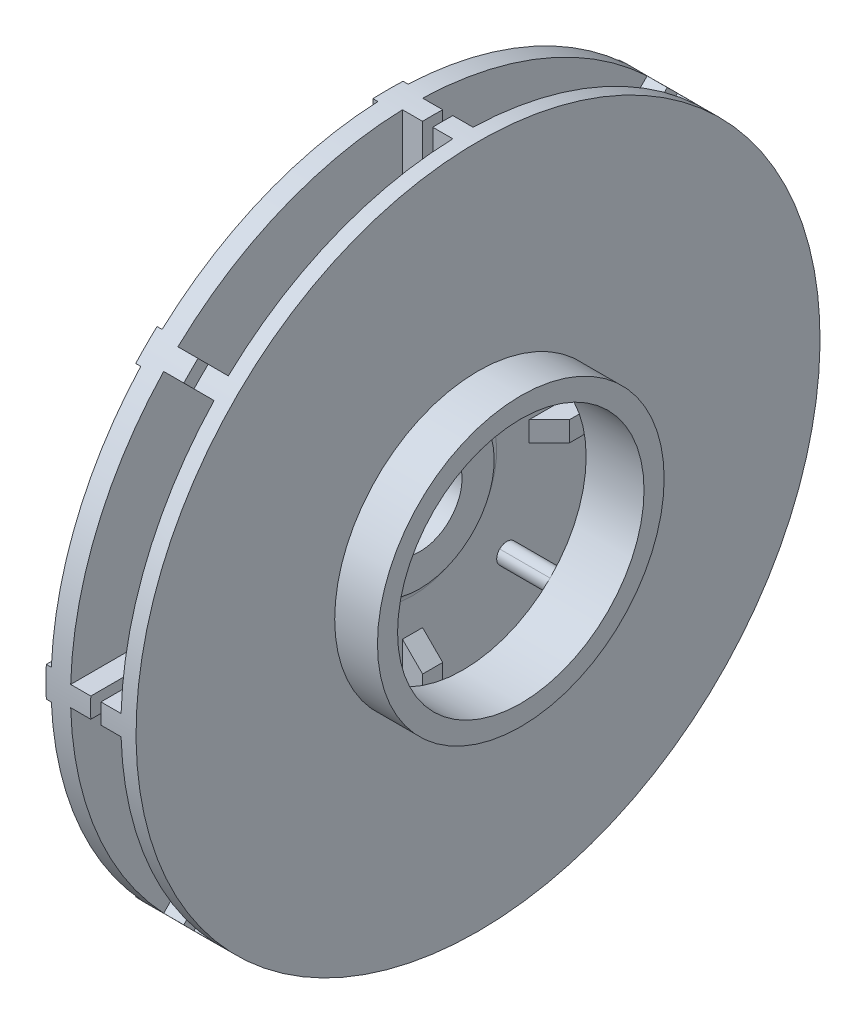
from build123d import *

# Parameters (mm, degrees)
BOSS_EXTRUDE3_DEPTH      = 6.35
FILLET1_R                = 6.35
CIRPATTERN5_COUNT        = 4
FILLET1_OF_CIRPATTERN5_R = 6.35
BOSS_EXTRUDE4_DEPTH      = 6.35
CIRPATTERN4_COUNT        = 4
SKETCH6_R                = 234.193665804
SKETCH6_R_2              = 215.9
CUT_EXTRUDE1_DEPTH       = 350.00288517
FILLET2_R                = 0.635
SKETCH7_R                = 60.93897947
CUT_EXTRUDE2_DEPTH       = 4.953
SKETCH8_R                = 79.670197019
CUT_EXTRUDE3_DEPTH       = 18.9484
CUT_EXTRUDE4_START       = 20.32
SKETCH11_R               = 219.71
SKETCH11_R_2             = 50.8
CUT_EXTRUDE4_DEPTH       = 20.32
CUT_EXTRUDE10_REACH      = 337.887
SKETCH20_R               = 30.226
SKETCH20_R_2             = 26.8224
CUT_EXTRUDE11_DEPTH      = 2.0066
CUT_EXTRUDE13_DEPTH      = 3.175
CIRPATTERN6_COUNT        = 8
SKETCH24_W               = 27.0002
SKETCH24_H               = 10.092146942
SKETCH25_R               = 26.6827
CUT_EXTRUDE14_DEPTH      = 20.32


with BuildPart() as part:
    # Sketch1 → Revolve2 (revolve)
    with BuildSketch(Plane.XY, mode=Mode.PRIVATE) as revolve2_sk:
        with BuildLine():
            Line((-140.081298787, 50.8), (-140.081298787, 0))
            Line((-140.081298787, 0), (-39.979898787, 0))
            Line((-39.979898787, 0), (-39.979898787, 46.736))
            Line((-39.979898787, 46.736), (-43.154898787, 46.736))
            ThreePointArc((-43.154898787, 46.736), (-47.645026847, 48.595871939), (-49.504898787, 53.086))
            Line((-49.504898787, 53.086), (-49.504898787, 219.71))
            Line((-49.504898787, 219.71), (-64.998898787, 219.71))
            Line((-64.998898787, 219.71), (-64.998898787, 63.5))
            ThreePointArc((-64.998898787, 63.5), (-68.718642666, 54.519743879), (-77.698898787, 50.8))
            Line((-77.698898787, 50.8), (-140.081298787, 50.8))
        make_face()
        with BuildLine():
            Line((-9.677698787, 219.71), (-17.678698787, 219.71))
            Line((-17.678698787, 219.71), (-17.678698787, 77.7875))
            Line((-17.678698787, 77.7875), (1.650701213, 77.7875))
            Line((1.650701213, 77.7875), (18.846501213, 77.7875))
            Line((18.846501213, 77.7875), (18.846501213, 93.599))
            ThreePointArc((18.846501213, 93.599), (18.400131948, 94.676630735), (17.322501213, 95.123))
            Line((17.322501213, 95.123), (-6.629698787, 95.123))
            ThreePointArc((-6.629698787, 95.123), (-7.707329521, 95.569369265), (-8.153698787, 96.647))
            Line((-8.153698787, 96.647), (-8.153698787, 218.186))
            ThreePointArc((-8.153698787, 218.186), (-8.600068052, 219.263630735), (-9.677698787, 219.71))
        make_face()
    revolve(revolve2_sk.sketch.rotate(Axis((-140.081298787, 0, 0), (1, 0, 0)), 180), axis=Axis((-140.081298787, 0, 0), (1, 0, 0)))

    # Sketch4 → Boss-Extrude3 (add, symmetric)
    with BuildSketch(Plane(origin=(0, 0, 0), x_dir=(1, 0, 0), z_dir=(0, -0.7071067811865488, 0.7071067811865464))):
        Polygon((-17.678698787, 219.71), (-30.378698787, 219.71), (-30.378698787, 130.302), (-36.804898787, 130.302), (-36.804898787, 219.71), (-49.504898787, 219.71), (-49.504898787, 77.7875), (-17.678698787, 77.7875), align=None)
    boss_extrude3 = extrude(amount=BOSS_EXTRUDE3_DEPTH, both=True)

    # Fillet1
    # the kernel refuses this fillet: 6.35 mm, written as the material it takes off along each edge
    with BuildSketch(Plane(origin=(-30.378698787, 87.647299742, 96.627555863), x_dir=(0, -0.7071067811865464, -0.7071067811865486), z_dir=(-1, 0, 0))) as fillet1_piece_1:
        with BuildLine():
            CenterArc((FILLET1_R, -FILLET1_R), FILLET1_R, 90, 90)
            Line((0, -FILLET1_R), (0, 0))
            Line((0, 0), (FILLET1_R, 0))
        make_face()
    extrude(amount=6.4262, mode=Mode.SUBTRACT)
    with BuildSketch(Plane(origin=(-30.378698787, 96.627555863, 87.647299742), x_dir=(0, -0.7071067811865464, -0.7071067811865486), z_dir=(-1, 0, 0))) as fillet1_piece_2:
        with BuildLine():
            CenterArc((FILLET1_R, FILLET1_R), FILLET1_R, 180, 90)
            Line((0, FILLET1_R), (0, 0))
            Line((0, 0), (FILLET1_R, 0))
        make_face()
    extrude(amount=6.4262, mode=Mode.SUBTRACT)
    with BuildSketch(Plane(origin=(-49.504898787, 59.494196802, 50.513940681), x_dir=(0, 0.707106781186547, 0.7071067811865481), z_dir=(1, 0, 0)), Plane(origin=(-49.504898787, 50.513940681, 59.494196802), x_dir=(0, 0.7071067811865492, -0.7071067811865459), z_dir=(1, 0, 0))) as fillet1_piece_3:
        with BuildLine():
            CenterArc((FILLET1_R, FILLET1_R), FILLET1_R, 180, 90)
            Line((0, FILLET1_R), (0, 0))
            Line((0, 0), (FILLET1_R, 0))
        make_face()
    extrude(amount=31.8262, mode=Mode.SUBTRACT)

    # CirPattern5: Boss-Extrude3 ×4 about axis
    cirpattern5_axis = Axis((0, 0, 0), (1, 0, 0))
    for i in range(1, CIRPATTERN5_COUNT):
        add(boss_extrude3.rotate(cirpattern5_axis, i * 360 / CIRPATTERN5_COUNT))

    # Fillet1 of CirPattern5
    # the kernel refuses this fillet: 6.35 mm, written as the material it takes off along each edge
    with BuildSketch(Plane(origin=(-30.378698787, -96.627555863, 87.647299742), x_dir=(0, 0.7071067811865509, -0.7071067811865441), z_dir=(-1, 0, 0)), Plane(origin=(-30.378698787, -87.647299742, -96.627555863), x_dir=(0, 0.7071067811865452, 0.7071067811865498), z_dir=(-1, 0, 0)), Plane(origin=(-30.378698787, 96.627555863, -87.647299742), x_dir=(0, -0.7071067811865498, 0.7071067811865454), z_dir=(-1, 0, 0))) as fillet1_of_cirpattern5_piece_1:
        with BuildLine():
            CenterArc((FILLET1_OF_CIRPATTERN5_R, -FILLET1_OF_CIRPATTERN5_R), FILLET1_OF_CIRPATTERN5_R, 90, 90)
            Line((0, -FILLET1_OF_CIRPATTERN5_R), (0, 0))
            Line((0, 0), (FILLET1_OF_CIRPATTERN5_R, 0))
        make_face()
    extrude(amount=6.4262, mode=Mode.SUBTRACT)
    with BuildSketch(Plane(origin=(-30.378698787, -87.647299742, 96.627555863), x_dir=(0, 0.7071067811865509, -0.7071067811865441), z_dir=(-1, 0, 0)), Plane(origin=(-30.378698787, -96.627555863, -87.647299742), x_dir=(0, 0.7071067811865441, 0.7071067811865509), z_dir=(-1, 0, 0)), Plane(origin=(-30.378698787, 87.647299742, -96.627555863), x_dir=(0, -0.7071067811865509, 0.7071067811865441), z_dir=(-1, 0, 0))) as fillet1_of_cirpattern5_piece_2:
        with BuildLine():
            CenterArc((FILLET1_OF_CIRPATTERN5_R, FILLET1_OF_CIRPATTERN5_R), FILLET1_OF_CIRPATTERN5_R, 180, 90)
            Line((0, FILLET1_OF_CIRPATTERN5_R), (0, 0))
            Line((0, 0), (FILLET1_OF_CIRPATTERN5_R, 0))
        make_face()
    extrude(amount=6.4262, mode=Mode.SUBTRACT)
    with BuildSketch(Plane(origin=(-49.504898787, -50.513940681, 59.494196802), x_dir=(0, -0.7071067811865475, 0.7071067811865475), z_dir=(1, 0, 0)), Plane(origin=(-49.504898787, -59.494196802, 50.513940681), x_dir=(0, 0.7071067811865464, 0.7071067811865486), z_dir=(1, 0, 0)), Plane(origin=(-49.504898787, -59.494196802, -50.513940681), x_dir=(0, -0.7071067811865481, -0.707106781186547), z_dir=(1, 0, 0)), Plane(origin=(-49.504898787, -50.513940681, -59.494196802), x_dir=(0, -0.7071067811865486, 0.7071067811865464), z_dir=(1, 0, 0)), Plane(origin=(-49.504898787, 50.513940681, -59.494196802), x_dir=(0, 0.7071067811865476, -0.7071067811865476), z_dir=(1, 0, 0)), Plane(origin=(-49.504898787, 59.494196802, -50.513940681), x_dir=(0, -0.7071067811865459, -0.7071067811865492), z_dir=(1, 0, 0))) as fillet1_of_cirpattern5_piece_3:
        with BuildLine():
            CenterArc((FILLET1_OF_CIRPATTERN5_R, FILLET1_OF_CIRPATTERN5_R), FILLET1_OF_CIRPATTERN5_R, 180, 90)
            Line((0, FILLET1_OF_CIRPATTERN5_R), (0, 0))
            Line((0, 0), (FILLET1_OF_CIRPATTERN5_R, 0))
        make_face()
    extrude(amount=31.8262, mode=Mode.SUBTRACT)

    # Sketch5 → Boss-Extrude4 (add, symmetric)
    with BuildSketch(Plane(origin=(0, 0, 0), x_dir=(-1, 0, 0), z_dir=(0, 0, -1))):
        Polygon((49.504898787, 219.71), (49.504898787, 73.66), (36.804898787, 86.36), (36.804898787, 219.71), align=None)
        Polygon((17.678698787, 77.7875), (17.678698787, 219.71), (30.378698787, 219.71), (30.378698787, 90.4875), align=None)
    boss_extrude4 = extrude(amount=BOSS_EXTRUDE4_DEPTH, both=True)

    # CirPattern4: Boss-Extrude4 ×4 about axis
    cirpattern4_axis = Axis((0, 0, 0), (1, 0, 0))
    for i in range(1, CIRPATTERN4_COUNT):
        add(boss_extrude4.rotate(cirpattern4_axis, i * 360 / CIRPATTERN4_COUNT))

    # Sketch6 → Cut-Extrude1 (cut, through all)
    with BuildSketch(Plane.ZY.offset(140.081298787)):
        Circle(SKETCH6_R)
        with Locations(Location((0, 0, 0), (0, 0, 270))):
            Circle(SKETCH6_R_2, mode=Mode.SUBTRACT)
    extrude(amount=-CUT_EXTRUDE1_DEPTH, mode=Mode.SUBTRACT)

    # Fillet2
    fillet2_edges = [part.edges().sort_by_distance(p)[0] for p in [
        (-39.979898787, 46.736, 0),
    ]]
    fillet(fillet2_edges, radius=FILLET2_R)

    # Sketch7 → Cut-Extrude2 (cut)
    with BuildSketch(Plane(origin=(-39.979898787, 0, 0), x_dir=(0, 0, -1), z_dir=(1, 0, 0))):
        Circle(SKETCH7_R)
    extrude(amount=-CUT_EXTRUDE2_DEPTH, mode=Mode.SUBTRACT)

    # Sketch8 → Cut-Extrude3 (cut)
    with BuildSketch(Plane.ZY.offset(140.081298787)):
        Circle(SKETCH8_R)
    extrude(amount=-CUT_EXTRUDE3_DEPTH, mode=Mode.SUBTRACT)

    # Sketch11 → Cut-Extrude4 (cut)
    with BuildSketch(Plane.ZY.offset(64.998898787).offset(CUT_EXTRUDE4_START)):
        Circle(SKETCH11_R)
        with Locations(Location((0, 0, 0), (0, 0, 270))):
            Circle(SKETCH11_R_2, mode=Mode.SUBTRACT)
    extrude(amount=-CUT_EXTRUDE4_DEPTH, mode=Mode.SUBTRACT)

    # Sketch12 → Cut-Revolve1 (revolve, cut)
    with BuildSketch(Plane(origin=(0, 0, 0), x_dir=(1, 0, 0), z_dir=(0, 1, 0)), mode=Mode.PRIVATE) as cut_revolve1_sk:
        with BuildLine():
            Line((-121.132898787, 31.75), (-80.111898787, 31.75))
            ThreePointArc((-80.111898787, 31.75), (-76.957987839, 32.588616713), (-74.637123327, 34.882961973))
            Line((-74.637123327, 34.882961973), (-65.874123327, 49.795890249))
            ThreePointArc((-65.874123327, 49.795890249), (-65.613530636, 50.287482958), (-65.396970658, 50.8))
            Line((-65.396970658, 50.8), (-121.132898787, 50.8))
            Line((-121.132898787, 50.8), (-121.132898787, 31.75))
        make_face()
    revolve(cut_revolve1_sk.sketch.rotate(Axis((-60.172898787, 0, 0), (-1, 0, 0)), 270), axis=Axis((-60.172898787, 0, 0), (-1, 0, 0)), mode=Mode.SUBTRACT)

    # Sketch18 → Cut-Extrude10 (cut, up to next)
    with BuildSketch(Plane.ZY.offset(121.132898787), mode=Mode.PRIVATE) as cut_extrude10_sk1:
        with BuildLine():
            Line((-14.359429538, -21.094621628), (-21.094621628, -14.359429538))
            Line((-21.094621628, -14.359429538), (-17.575856913, -10.840664823))
            ThreePointArc((-17.575856913, -10.840664823), (14.601896453, 14.601896453), (-10.840664823, -17.575856913))
            Line((-10.840664823, -17.575856913), (-14.359429538, -21.094621628))
        make_face()
    cut_extrude10_tool1 = extrude(cut_extrude10_sk1.sketch, amount=-CUT_EXTRUDE10_REACH, mode=Mode.PRIVATE) & part.part
    add(cut_extrude10_tool1.solids().sort_by_distance((-121.132899, -0.51024, -0.51024))[0], mode=Mode.SUBTRACT)

    # Sketch20 → Cut-Extrude11 (cut)
    with BuildSketch(Plane.ZY.offset(121.132898787)):
        with Locations(Location((0, 0, 0), (0, 0, 270))):
            Circle(SKETCH20_R)
        with Locations(Location((0, 0, 0), (0, 0, 270))):
            Circle(SKETCH20_R_2, mode=Mode.SUBTRACT)
    extrude(amount=-CUT_EXTRUDE11_DEPTH, mode=Mode.SUBTRACT)

    # Sketch22 → Cut-Extrude13 (cut)
    with BuildSketch(Plane.ZY.offset(64.998898787)):
        with BuildLine():
            Line((50.92871008, 64.399094261), (145.78051919, 159.250903372))
            ThreePointArc((145.78051919, 159.250903372), (82.621353048, 199.465591069), (9.525, 215.689787368))
            Line((9.525, 215.689787368), (9.525, 84.123223233))
            ThreePointArc((9.525, 84.123223233), (24.00104092, 61.192302667), (50.92871008, 64.399094261))
        make_face()
    cut_extrude13 = extrude(amount=-CUT_EXTRUDE13_DEPTH, mode=Mode.SUBTRACT)

    # CirPattern6: Cut-Extrude13 ×8 about axis
    cirpattern6_axis = Axis((0, 0, 0), (1, 0, 0))
    for i in range(1, CIRPATTERN6_COUNT):
        add(cut_extrude13.rotate(cirpattern6_axis, i * 360 / CIRPATTERN6_COUNT), mode=Mode.SUBTRACT)

    # Sketch24 → Cut-Revolve2 (revolve, cut)
    with BuildSketch(Plane(origin=(0, 0, 0), x_dir=(1, 0, 0), z_dir=(0, 1, 0)), mode=Mode.PRIVATE) as cut_revolve2_sk:
        with Locations((5.346401213, 95.533573471)):
            Rectangle(SKETCH24_W, SKETCH24_H)
    revolve(cut_revolve2_sk.sketch.rotate(Axis((-154.951085714, 0, 0), (1, 0, 0)), 271.68541304), axis=Axis((-154.951085714, 0, 0), (1, 0, 0)), mode=Mode.SUBTRACT)

    # Sketch25 → Cut-Extrude14 (cut)
    with BuildSketch(Plane(origin=(-44.932898787, 0, 0), x_dir=(0, 0, -1), z_dir=(1, 0, 0))):
        with Locations(Location((0, 0, 0), (0, 0, 90))):
            Circle(SKETCH25_R)
    extrude(amount=-CUT_EXTRUDE14_DEPTH, mode=Mode.SUBTRACT)


solid = part.part
